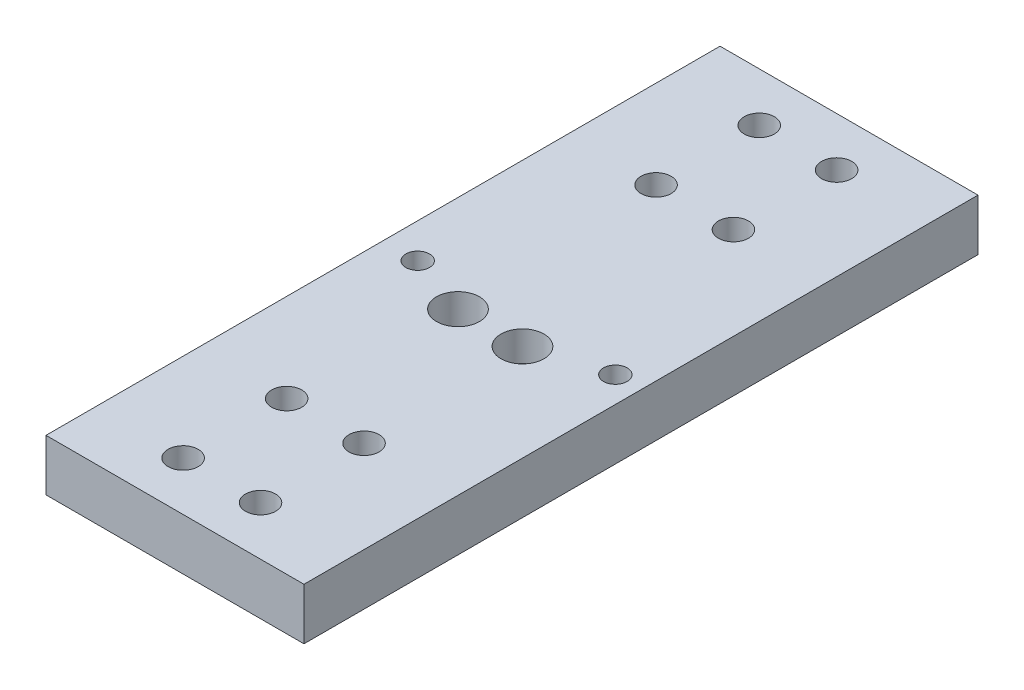
from build123d import *

# Parameters (mm, degrees)
SKETCH3_W           = 156.772980402
SKETCH3_H           = 60
BOSS_EXTRUDE6_DEPTH = 12
CUT_EXTRUDE1_REACH  = 112.192
SKETCH4_R           = 2.25
CUT_EXTRUDE2_REACH  = 112.192
SKETCH6_R           = 3.25
SKETCH7_R           = 3.5
CUT_EXTRUDE3_DEPTH  = 5
SKETCH8_R           = 5
CUT_EXTRUDE4_DEPTH  = 7
CUT_EXTRUDE5_REACH  = 112.192
SKETCH9_R           = 2.75


with BuildPart() as part:
    # Sketch3 → Boss-Extrude6 (new body)
    with BuildSketch(Plane(origin=(-27.52701042, 0, 0), x_dir=(0, 0, 1), z_dir=(0, 1, 0))):
        with Locations((-23.695908121, 17.809773729)):
            Rectangle(SKETCH3_W, SKETCH3_H)
    extrude(amount=BOSS_EXTRUDE6_DEPTH)

    # Sketch4 → Cut-Extrude1 (cut, up to next)
    with BuildSketch(Plane(origin=(0, 12, 0), x_dir=(1, 0, 0), z_dir=(0, 1, 0)), mode=Mode.PRIVATE) as cut_extrude1_sk1:
        with Locations((-1.126993796, -19.304091879)):
            Circle(SKETCH4_R)
    cut_extrude1_tool1 = extrude(cut_extrude1_sk1.sketch, amount=-CUT_EXTRUDE1_REACH, mode=Mode.PRIVATE) & part.part
    # Sketch4 → Cut-Extrude1 (cut, up to next)
    with BuildSketch(Plane(origin=(0, 12, 0), x_dir=(1, 0, 0), z_dir=(0, 1, 0)), mode=Mode.PRIVATE) as cut_extrude1_sk2:
        with Locations((-19.127096376, -19.304091879)):
            Circle(SKETCH4_R)
    cut_extrude1_tool2 = extrude(cut_extrude1_sk2.sketch, amount=-CUT_EXTRUDE1_REACH, mode=Mode.PRIVATE) & part.part
    # Sketch4 → Cut-Extrude1 (cut, up to next)
    with BuildSketch(Plane(origin=(0, 12, 0), x_dir=(1, 0, 0), z_dir=(0, 1, 0)), mode=Mode.PRIVATE) as cut_extrude1_sk3:
        with Locations((-1.2080193, -43.304091879)):
            Circle(SKETCH4_R)
    cut_extrude1_tool3 = extrude(cut_extrude1_sk3.sketch, amount=-CUT_EXTRUDE1_REACH, mode=Mode.PRIVATE) & part.part
    # Sketch4 → Cut-Extrude1 (cut, up to next)
    with BuildSketch(Plane(origin=(0, 12, 0), x_dir=(1, 0, 0), z_dir=(0, 1, 0)), mode=Mode.PRIVATE) as cut_extrude1_sk4:
        with Locations((-19.208121879, -43.304091879)):
            Circle(SKETCH4_R)
    cut_extrude1_tool4 = extrude(cut_extrude1_sk4.sketch, amount=-CUT_EXTRUDE1_REACH, mode=Mode.PRIVATE) & part.part
    # Sketch4 → Cut-Extrude1 (cut, up to next)
    with BuildSketch(Plane(origin=(0, 12, 0), x_dir=(1, 0, 0), z_dir=(0, 1, 0)), mode=Mode.PRIVATE) as cut_extrude1_sk5:
        with Locations((-19.208121879, 66.695908121)):
            Circle(SKETCH4_R)
    cut_extrude1_tool5 = extrude(cut_extrude1_sk5.sketch, amount=-CUT_EXTRUDE1_REACH, mode=Mode.PRIVATE) & part.part
    # Sketch4 → Cut-Extrude1 (cut, up to next)
    with BuildSketch(Plane(origin=(0, 12, 0), x_dir=(1, 0, 0), z_dir=(0, 1, 0)), mode=Mode.PRIVATE) as cut_extrude1_sk6:
        with Locations((-19.208121879, 90.695908121)):
            Circle(SKETCH4_R)
    cut_extrude1_tool6 = extrude(cut_extrude1_sk6.sketch, amount=-CUT_EXTRUDE1_REACH, mode=Mode.PRIVATE) & part.part
    # Sketch4 → Cut-Extrude1 (cut, up to next)
    with BuildSketch(Plane(origin=(0, 12, 0), x_dir=(1, 0, 0), z_dir=(0, 1, 0)), mode=Mode.PRIVATE) as cut_extrude1_sk7:
        with Locations((-1.2080193, 90.695908121)):
            Circle(SKETCH4_R)
    cut_extrude1_tool7 = extrude(cut_extrude1_sk7.sketch, amount=-CUT_EXTRUDE1_REACH, mode=Mode.PRIVATE) & part.part
    # Sketch4 → Cut-Extrude1 (cut, up to next)
    with BuildSketch(Plane(origin=(0, 12, 0), x_dir=(1, 0, 0), z_dir=(0, 1, 0)), mode=Mode.PRIVATE) as cut_extrude1_sk8:
        with Locations((-1.2080193, 66.695908121)):
            Circle(SKETCH4_R)
    cut_extrude1_tool8 = extrude(cut_extrude1_sk8.sketch, amount=-CUT_EXTRUDE1_REACH, mode=Mode.PRIVATE) & part.part
    add(cut_extrude1_tool1.solids().sort_by_distance((-1.126994, 12, 19.304092))[0], mode=Mode.SUBTRACT)
    add(cut_extrude1_tool2.solids().sort_by_distance((-19.127096, 12, 19.304092))[0], mode=Mode.SUBTRACT)
    add(cut_extrude1_tool3.solids().sort_by_distance((-1.208019, 12, 43.304092))[0], mode=Mode.SUBTRACT)
    add(cut_extrude1_tool4.solids().sort_by_distance((-19.208122, 12, 43.304092))[0], mode=Mode.SUBTRACT)
    add(cut_extrude1_tool5.solids().sort_by_distance((-19.208122, 12, -66.695908))[0], mode=Mode.SUBTRACT)
    add(cut_extrude1_tool6.solids().sort_by_distance((-19.208122, 12, -90.695908))[0], mode=Mode.SUBTRACT)
    add(cut_extrude1_tool7.solids().sort_by_distance((-1.208019, 12, -90.695908))[0], mode=Mode.SUBTRACT)
    add(cut_extrude1_tool8.solids().sort_by_distance((-1.208019, 12, -66.695908))[0], mode=Mode.SUBTRACT)

    # Sketch6 → Cut-Extrude2 (cut, up to next)
    with BuildSketch(Plane(origin=(0, 12, 0), x_dir=(1, 0, 0), z_dir=(0, 1, 0)), mode=Mode.PRIVATE) as cut_extrude2_sk1:
        with Locations((-17.217236691, 18.631632081)):
            Circle(SKETCH6_R)
    cut_extrude2_tool1 = extrude(cut_extrude2_sk1.sketch, amount=-CUT_EXTRUDE2_REACH, mode=Mode.PRIVATE) & part.part
    # Sketch6 → Cut-Extrude2 (cut, up to next)
    with BuildSketch(Plane(origin=(0, 12, 0), x_dir=(1, 0, 0), z_dir=(0, 1, 0)), mode=Mode.PRIVATE) as cut_extrude2_sk2:
        with Locations((-2.217236691, 18.631632081)):
            Circle(SKETCH6_R)
    cut_extrude2_tool2 = extrude(cut_extrude2_sk2.sketch, amount=-CUT_EXTRUDE2_REACH, mode=Mode.PRIVATE) & part.part
    add(cut_extrude2_tool1.solids().sort_by_distance((-17.217237, 12, -18.631632))[0], mode=Mode.SUBTRACT)
    add(cut_extrude2_tool2.solids().sort_by_distance((-2.217237, 12, -18.631632))[0], mode=Mode.SUBTRACT)

    # Sketch7 → Cut-Extrude3 (cut)
    with BuildSketch(Plane(origin=(0, 12, 0), x_dir=(1, 0, 0), z_dir=(0, 1, 0))):
        with Locations((-19.127096376, -19.304091879)):
            Circle(SKETCH7_R)
        with Locations((-19.208121879, -43.304091879)):
            Circle(SKETCH7_R)
        with Locations((-1.2080193, -43.304091879)):
            Circle(SKETCH7_R)
        with Locations((-1.126993796, -19.304091879)):
            Circle(SKETCH7_R)
        with Locations((-1.2080193, 66.695908121)):
            Circle(SKETCH7_R)
        with Locations((-19.208121879, 66.695908121)):
            Circle(SKETCH7_R)
        with Locations((-19.208121879, 90.695908121)):
            Circle(SKETCH7_R)
        with Locations((-1.2080193, 90.695908121)):
            Circle(SKETCH7_R)
    extrude(amount=-CUT_EXTRUDE3_DEPTH, mode=Mode.SUBTRACT)

    # Sketch8 → Cut-Extrude4 (cut)
    with BuildSketch(Plane(origin=(0, 12, 0), x_dir=(1, 0, 0), z_dir=(0, 1, 0))):
        with Locations((-17.217236691, 18.631632081)):
            Circle(SKETCH8_R)
        with Locations((-2.217236691, 18.631632081)):
            Circle(SKETCH8_R)
    extrude(amount=-CUT_EXTRUDE4_DEPTH, mode=Mode.SUBTRACT)

    # Sketch9 → Cut-Extrude5 (cut, up to next)
    with BuildSketch(Plane(origin=(0, 12, 0), x_dir=(1, 0, 0), z_dir=(0, 1, 0)), mode=Mode.PRIVATE) as cut_extrude5_sk1:
        with Locations((-31.657880115, 23.701844607)):
            Circle(SKETCH9_R)
    cut_extrude5_tool1 = extrude(cut_extrude5_sk1.sketch, amount=-CUT_EXTRUDE5_REACH, mode=Mode.PRIVATE) & part.part
    # Sketch9 → Cut-Extrude5 (cut, up to next)
    with BuildSketch(Plane(origin=(0, 12, 0), x_dir=(1, 0, 0), z_dir=(0, 1, 0)), mode=Mode.PRIVATE) as cut_extrude5_sk2:
        with Locations((14.282732382, 23.735684254)):
            Circle(SKETCH9_R)
    cut_extrude5_tool2 = extrude(cut_extrude5_sk2.sketch, amount=-CUT_EXTRUDE5_REACH, mode=Mode.PRIVATE) & part.part
    add(cut_extrude5_tool1.solids().sort_by_distance((-31.65788, 12, -23.701845))[0], mode=Mode.SUBTRACT)
    add(cut_extrude5_tool2.solids().sort_by_distance((14.282732, 12, -23.735684))[0], mode=Mode.SUBTRACT)


solid = part.part
